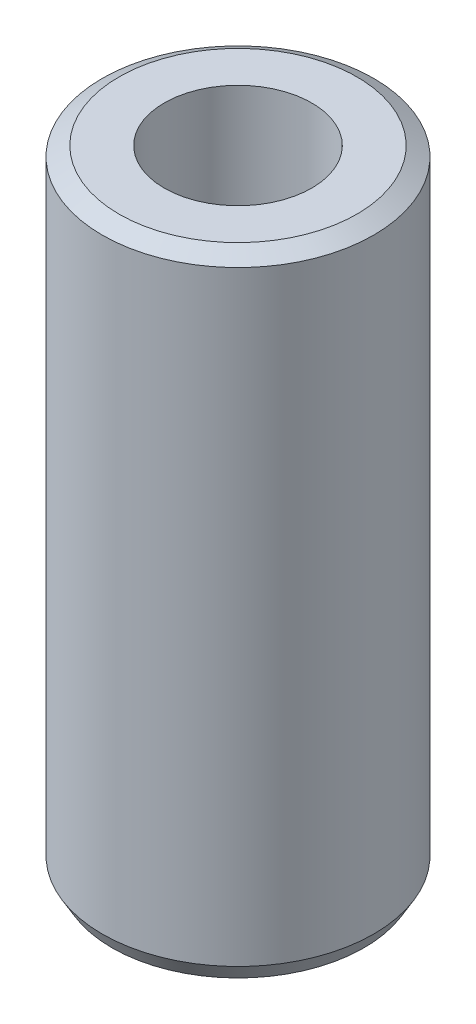
from build123d import *
from OCP.BRepFilletAPI import BRepFilletAPI_MakeChamfer

# Parameters (mm, degrees)
SKETCH1_R           = 32.5
BOSS_EXTRUDE1_DEPTH = 151.254654155
SKETCH2_R           = 17.665957615
CUT_EXTRUDE1_DEPTH  = 159.083744906
CHAMFER1_SIZE       = 2.325311376
CHAMFER1_SIZE2      = 4.027557447


with BuildPart() as part:
    # Sketch1 → Boss-Extrude1 (new body)
    with BuildSketch(Plane(origin=(0, 0, 0), x_dir=(1, 0, 0), z_dir=(0, 1, 0))):
        Circle(SKETCH1_R)
    extrude(amount=BOSS_EXTRUDE1_DEPTH)

    # Sketch2 → Cut-Extrude1 (cut, through all)
    with BuildSketch(Plane(origin=(0, 0, 0), x_dir=(1, 0, 0), z_dir=(0, 1, 0))):
        Circle(SKETCH2_R)
    extrude(amount=CUT_EXTRUDE1_DEPTH, mode=Mode.SUBTRACT)

    # Chamfer1: one chamfer whose edges measure the first distance from different faces: ONE call of the kernel's chamfer builder (chamfer() names one face for all edges)
    chamfer1_edges_1 = [part.edges().sort_by_distance(p)[0] for p in [
        (-32.5, 151.254654155, 0),
    ]]
    chamfer1_side_1 = [part.faces().sort_by_distance(p)[0] for p in [
        (-32.5, 75.627327077, 0),
    ]]
    chamfer1_edges_2 = [part.edges().sort_by_distance(p)[0] for p in [
        (-32.5, 0, 0),
    ]]
    chamfer1_side_2 = [part.faces().sort_by_distance(p)[0] for p in [
        (-31.580761184, 0, 0),
    ]]
    chamfer1 = BRepFilletAPI_MakeChamfer(part.part.solid().wrapped)
    for e in chamfer1_edges_1:
        chamfer1.Add(CHAMFER1_SIZE, CHAMFER1_SIZE2, e.wrapped, chamfer1_side_1[0].wrapped)  # the first distance lies on this face
    for e in chamfer1_edges_2:
        chamfer1.Add(CHAMFER1_SIZE, CHAMFER1_SIZE2, e.wrapped, chamfer1_side_2[0].wrapped)  # the first distance lies on this face
    add(Compound.cast(chamfer1.Shape()), mode=Mode.REPLACE)


solid = part.part
